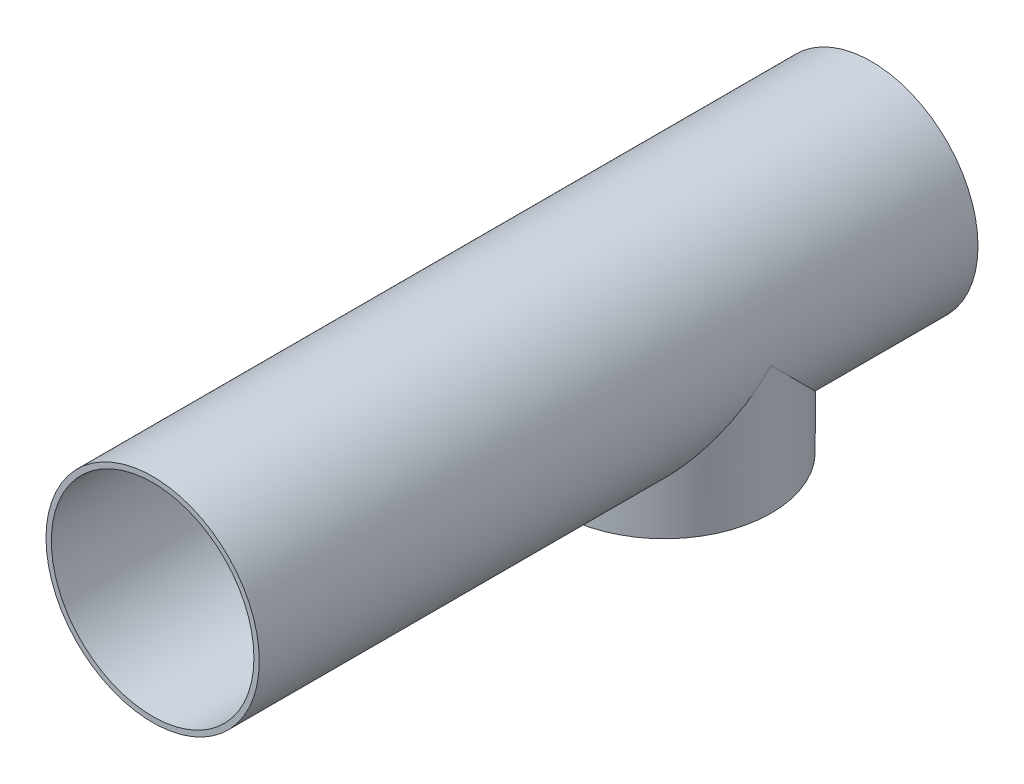
from build123d import *

# Parameters (mm, degrees)
STRUCTURAL_START                 = -76.2
STRUCTURAL_MEMBER1_OUTLINE_R     = 63.5
STRUCTURAL_MEMBER1_OUTLINE_R_2   = 60.325
STRUCTURAL_MEMBER1_DEPTH         = 12.6999999
STRUCTURAL_START_2               = -63.5000001
STRUCTURAL_MEMBER1_2_OUTLINE_R   = 63.5
STRUCTURAL_MEMBER1_2_OUTLINE_R_2 = 60.325
STRUCTURAL_MEMBER1_2_DEPTH       = 63.5000002
STRUCTURAL_START_3               = -369
STRUCTURAL_MEMBER1_3_DEPTH       = 129
STRUCTURAL_START_4               = -427.99
STRUCTURAL_MEMBER1_4_OUTLINE_R   = 63.5
STRUCTURAL_MEMBER1_4_OUTLINE_R_2 = 60.325
STRUCTURAL_MEMBER1_4_DEPTH       = 427.99
SKETCH3_R                        = 53.975
CUT_EXTRUDE3_DEPTH               = 88.9


with BuildPart() as part:
    # Structural Member1: read off the stored shape, not the designer's step
    # Structural Member1 outline → Structural Member1 (new body)
    with BuildSketch(Plane(origin=(0, 0, 0), x_dir=(1, 0, 0), z_dir=(0, 1, 0)).offset(STRUCTURAL_START)):
        with Locations((0, 304.8)):
            Circle(STRUCTURAL_MEMBER1_OUTLINE_R)
        with Locations((0, 304.8)):
            Circle(STRUCTURAL_MEMBER1_OUTLINE_R_2, mode=Mode.SUBTRACT)
    extrude(amount=STRUCTURAL_MEMBER1_DEPTH)

    # Structural Member1 2 outline → Structural Member1 2 (add)
    with BuildSketch(Plane(origin=(0, 0, 0), x_dir=(1, 0, 0), z_dir=(0, 1, 0)).offset(STRUCTURAL_START_2)):
        with Locations((0, 304.8)):
            Circle(STRUCTURAL_MEMBER1_2_OUTLINE_R)
        with Locations((0, 304.8)):
            Circle(STRUCTURAL_MEMBER1_2_OUTLINE_R_2, mode=Mode.SUBTRACT)
    extrude(amount=STRUCTURAL_MEMBER1_2_DEPTH)

    # Structural Member1 3 outline → Structural Member1 3 (cut)
    with BuildSketch(Plane.XY.offset(STRUCTURAL_START_3)):
        with BuildLine():
            Line((63.5, 0), (-63.5, 0))
            ThreePointArc((-63.5, 0), (0, -63.5), (63.5, 0))
        make_face()
    extrude(amount=STRUCTURAL_MEMBER1_3_DEPTH, mode=Mode.SUBTRACT)


with BuildPart() as body_2:
    # Structural Member1 4 outline → Structural Member1 4 (new body)
    with BuildSketch(Plane.XY.offset(STRUCTURAL_START_4)):
        Circle(STRUCTURAL_MEMBER1_4_OUTLINE_R)
        Circle(STRUCTURAL_MEMBER1_4_OUTLINE_R_2, mode=Mode.SUBTRACT)
    extrude(amount=STRUCTURAL_MEMBER1_4_DEPTH)

    # Sketch3 → Cut-Extrude3 (cut)
    with BuildSketch(Plane.XZ.offset(76.2)):
        with Locations((0, -304.8)):
            Circle(SKETCH3_R)
    extrude(amount=-CUT_EXTRUDE3_DEPTH, mode=Mode.SUBTRACT)


solid = Compound([part.part, body_2.part])
